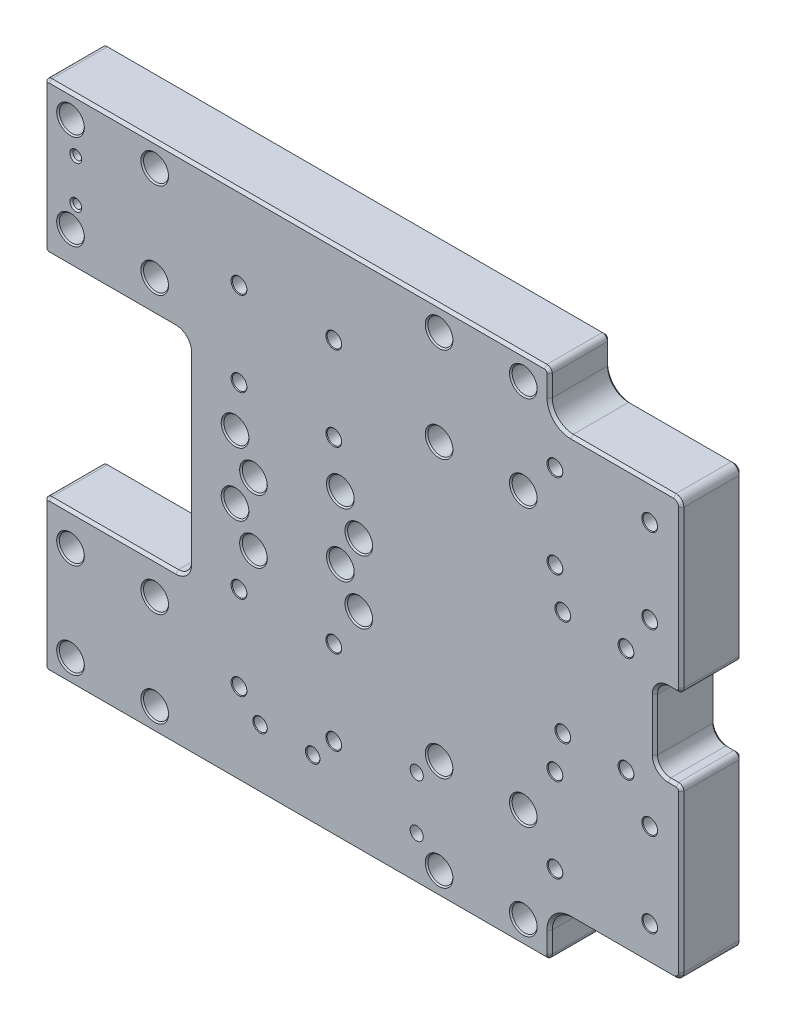
from build123d import *
from OCP.BRepFilletAPI import BRepFilletAPI_MakeFillet

# Parameters (mm, degrees)
SKETCH1_W                                     = 242
SKETCH1_H                                     = 195
BASE_FLANGE1_DEPTH                            = 23
CBORE_FOR_M5_HEX_SOCKET_HEAD_CAP_SCR_2_COUNT  = 2
CBORE_FOR_M5_HEX_SOCKET_HEAD_CAP_SCR_2_PITCH  = 32
CBORE_FOR_M5_HEX_SOCKET_HEAD_CAP_SCR_3_COUNT  = 2
CBORE_FOR_M5_HEX_SOCKET_HEAD_CAP_SCR_3_PITCH  = 48.166378315
CBORE_FOR_M5_HEX_SOCKET_HEAD_CAP_SCR_4_COUNT  = 2
CBORE_FOR_M5_HEX_SOCKET_HEAD_CAP_SCR_4_PITCH  = 36
CBORE_FOR_M5_HEX_SOCKET_HEAD_CAP_SCR_5_COUNT  = 2
CBORE_FOR_M5_HEX_SOCKET_HEAD_CAP_SCR_5_PITCH  = 140
CBORE_FOR_M5_HEX_SOCKET_HEAD_CAP_SCR_6_COUNT  = 2
CBORE_FOR_M5_HEX_SOCKET_HEAD_CAP_SCR_6_PITCH  = 172
CBORE_FOR_M5_HEX_SOCKET_HEAD_CAP_SCR_7_COUNT  = 2
CBORE_FOR_M5_HEX_SOCKET_HEAD_CAP_SCR_7_PITCH  = 175.727061092
CBORE_FOR_M5_HEX_SOCKET_HEAD_CAP_SCR_8_COUNT  = 2
CBORE_FOR_M5_HEX_SOCKET_HEAD_CAP_SCR_8_PITCH  = 144.554487997
CBORE_FOR_M5_HEX_SOCKET_HEAD_CAP_SCR_9_COUNT  = 2
CBORE_FOR_M5_HEX_SOCKET_HEAD_CAP_SCR_9_PITCH  = 198.698263707
CBORE_FOR_M5_HEX_SOCKET_HEAD_CAP_SCR_10_COUNT = 2
CBORE_FOR_M5_HEX_SOCKET_HEAD_CAP_SCR_10_PITCH = 222.407284053
CBORE_FOR_M5_HEX_SOCKET_HEAD_CAP_SCR_11_COUNT = 2
CBORE_FOR_M5_HEX_SOCKET_HEAD_CAP_SCR_11_PITCH = 246.805591509
CBORE_FOR_M5_HEX_SOCKET_HEAD_CAP_SCR_12_COUNT = 2
CBORE_FOR_M5_HEX_SOCKET_HEAD_CAP_SCR_12_PITCH = 225.674544422
CBORE_FOR_M5_HEX_SOCKET_HEAD_CAP_SCR_13_COUNT = 2
CBORE_FOR_M5_HEX_SOCKET_HEAD_CAP_SCR_13_PITCH = 141
CBORE_FOR_M5_HEX_SOCKET_HEAD_CAP_SCR_14_COUNT = 2
CBORE_FOR_M5_HEX_SOCKET_HEAD_CAP_SCR_14_PITCH = 144.585614775
CBORE_FOR_M5_HEX_SOCKET_HEAD_CAP_SCR_15_COUNT = 2
CBORE_FOR_M5_HEX_SOCKET_HEAD_CAP_SCR_15_PITCH = 179.869397064
CBORE_FOR_M5_HEX_SOCKET_HEAD_CAP_SCR_16_COUNT = 2
CBORE_FOR_M5_HEX_SOCKET_HEAD_CAP_SCR_16_PITCH = 177
CBORE_FOR_M5_HEX_SOCKET_HEAD_CAP_SCR_17_COUNT = 2
CBORE_FOR_M5_HEX_SOCKET_HEAD_CAP_SCR_17_PITCH = 40
CBORE_FOR_M5_HEX_SOCKET_HEAD_CAP_SCR_18_COUNT = 2
CBORE_FOR_M5_HEX_SOCKET_HEAD_CAP_SCR_18_PITCH = 46.647615159
CBORE_FOR_M5_HEX_SOCKET_HEAD_CAP_SCR_19_COUNT = 2
CBORE_FOR_M5_HEX_SOCKET_HEAD_CAP_SCR_19_PITCH = 24
CBORE_FOR_M5_HEX_SOCKET_HEAD_CAP_SCR_20_COUNT = 2
CBORE_FOR_M5_HEX_SOCKET_HEAD_CAP_SCR_20_PITCH = 13.892443989
CBORE_FOR_M5_HEX_SOCKET_HEAD_CAP_SCR_21_COUNT = 2
CBORE_FOR_M5_HEX_SOCKET_HEAD_CAP_SCR_21_PITCH = 35.114099732
CBORE_FOR_M5_HEX_SOCKET_HEAD_CAP_SCR_22_COUNT = 2
CBORE_FOR_M5_HEX_SOCKET_HEAD_CAP_SCR_22_PITCH = 48.836461788
CBORE_FOR_M5_HEX_SOCKET_HEAD_CAP_SCR_23_COUNT = 2
CBORE_FOR_M5_HEX_SOCKET_HEAD_CAP_SCR_23_PITCH = 36.674241642
CBORE_FOR_M5_HEX_SOCKET_HEAD_CAP_SCR_24_COUNT = 2
CBORE_FOR_M5_HEX_SOCKET_HEAD_CAP_SCR_24_PITCH = 36
CBORE_FOR_M5_HEX_SOCKET_HEAD_CAP_SCR_25_COUNT = 2
CBORE_FOR_M5_HEX_SOCKET_HEAD_CAP_SCR_25_PITCH = 48.166378315
CBORE_FOR_M5_HEX_SOCKET_HEAD_CAP_SCR_26_COUNT = 2
CBORE_FOR_M5_HEX_SOCKET_HEAD_CAP_SCR_26_PITCH = 32
CBORE_FOR_M5_HEX_SOCKET_HEAD_CAP_SCR_27_COUNT = 2
CBORE_FOR_M5_HEX_SOCKET_HEAD_CAP_SCR_27_PITCH = 106.282642045
CBORE_FOR_M5_HEX_SOCKET_HEAD_CAP_SCR_28_COUNT = 2
CBORE_FOR_M5_HEX_SOCKET_HEAD_CAP_SCR_28_PITCH = 136.821051012
CBORE_FOR_M5_HEX_SOCKET_HEAD_CAP_SCR_29_COUNT = 2
CBORE_FOR_M5_HEX_SOCKET_HEAD_CAP_SCR_29_PITCH = 100
CBORE_FOR_M5_HEX_SOCKET_HEAD_CAP_SCR_30_COUNT = 2
CBORE_FOR_M5_HEX_SOCKET_HEAD_CAP_SCR_30_PITCH = 132
CBORE_FOR_M5_HEX_SOCKET_HEAD_CAP_SCR_31_COUNT = 2
CBORE_FOR_M5_HEX_SOCKET_HEAD_CAP_SCR_31_PITCH = 120
CBORE_FOR_M5_HEX_SOCKET_HEAD_CAP_SCR_32_COUNT = 2
CBORE_FOR_M5_HEX_SOCKET_HEAD_CAP_SCR_32_PITCH = 156
CBORE_FOR_M5_HEX_SOCKET_HEAD_CAP_SCR_33_COUNT = 2
CBORE_FOR_M5_HEX_SOCKET_HEAD_CAP_SCR_33_PITCH = 159.248233899
CBORE_FOR_M5_HEX_SOCKET_HEAD_CAP_SCR_34_COUNT = 2
CBORE_FOR_M5_HEX_SOCKET_HEAD_CAP_SCR_34_PITCH = 124.19339757
CBORE_FOR_M5_HEX_SOCKET_HEAD_CAP_SCR_35_COUNT = 2
CBORE_FOR_M5_HEX_SOCKET_HEAD_CAP_SCR_35_PITCH = 185.29975715
CBORE_FOR_M5_HEX_SOCKET_HEAD_CAP_SCR_36_COUNT = 2
CBORE_FOR_M5_HEX_SOCKET_HEAD_CAP_SCR_36_PITCH = 204.352636391
CBORE_FOR_M5_HEX_SOCKET_HEAD_CAP_SCR_37_COUNT = 2
CBORE_FOR_M5_HEX_SOCKET_HEAD_CAP_SCR_37_PITCH = 156.204993518
CBORE_FOR_M5_HEX_SOCKET_HEAD_CAP_SCR_38_COUNT = 2
CBORE_FOR_M5_HEX_SOCKET_HEAD_CAP_SCR_38_PITCH = 178.392824968
CBORE_FOR_M5_HEX_SOCKET_HEAD_CAP_SCR_39_COUNT = 2
CBORE_FOR_M5_HEX_SOCKET_HEAD_CAP_SCR_39_PITCH = 40
CBORE_FOR_M5_HEX_SOCKET_HEAD_CAP_SCR_40_COUNT = 2
CBORE_FOR_M5_HEX_SOCKET_HEAD_CAP_SCR_40_PITCH = 46.647615159
CBORE_FOR_M5_HEX_SOCKET_HEAD_CAP_SCR_41_COUNT = 2
CBORE_FOR_M5_HEX_SOCKET_HEAD_CAP_SCR_41_PITCH = 24
CUT_EXTRUDE1_REACH                            = 159.087
SKETCH14_W                                    = 55
SKETCH14_H                                    = 80
SKETCH14_W_2                                  = 10
SKETCH14_H_2                                  = 30
M4_TAPPED_HOLE1_AT_2_COUNT                    = 2
M4_TAPPED_HOLE1_AT_2_PITCH                    = 16
CUT_EXTRUDE2_REACH                            = 159.087
SKETCH23_W                                    = 50
SKETCH23_H                                    = 18
F_5_0MM_DOWEL_HOLE1_D                         = 5
F_5_0MM_DOWEL_HOLE1_CSINK_D                   = 5.5
F_5_0MM_DOWEL_HOLE1_CSINK_ANGLE               = 90
F_5_0MM_DOWEL_HOLE2_D                         = 5
F_5_0MM_DOWEL_HOLE2_CSINK_D                   = 5.5
F_5_0MM_DOWEL_HOLE2_CSINK_ANGLE               = 90
FILLET1_R1                                    = 3
FILLET1_R2                                    = 5
FILLET1_R3                                    = 2
FILLET1_R4                                    = 8
CHAMFER1_SIZE                                 = 1
M5_TAPPED_HOLE1_D                             = 4.2
M5_TAPPED_HOLE1_DEPTH                         = 10.7381927
M5_TAPPED_HOLE1_TIP                           = 1.2618073


# Sheet-metal steps are written as plain solids
with BuildPart() as part:
    # Sketch1 → Base-Flange1 (new body)
    with BuildSketch(Plane.XY):
        Rectangle(SKETCH1_W, SKETCH1_H)
    extrude(amount=-BASE_FLANGE1_DEPTH)

    # Sketch8 → CBORE for M5 Hex Socket Head Cap Screw1 (revolve, cut)
    with BuildSketch(Plane(origin=(61, 88.5, 0), x_dir=(0, -1, 0), z_dir=(1, 0, 0))):
        Polygon((0, 0), (0, 23), (3, 23), (2.75, 22.75), (2.75, 8), (4.75, 8), (4.75, 0.5), (5.25, 0), align=None)
    cbore_for_m5_hex_socket_head_cap_screw1 = revolve(axis=Axis((61, 88.5, 6.35), (0, 0, -1)), mode=Mode.SUBTRACT)

    # CBORE for M5 Hex Socket Head Cap Scr 2: CBORE for M5 Hex Socket Head Cap Screw1 ×2
    with Locations(*[(-i * CBORE_FOR_M5_HEX_SOCKET_HEAD_CAP_SCR_2_PITCH, 0, 0) for i in range(1, CBORE_FOR_M5_HEX_SOCKET_HEAD_CAP_SCR_2_COUNT)]):
        add(cbore_for_m5_hex_socket_head_cap_screw1, mode=Mode.SUBTRACT)

    # CBORE for M5 Hex Socket Head Cap Scr 3: CBORE for M5 Hex Socket Head Cap Screw1 ×2
    with Locations(*[Vector(-0.6643638388299198, -0.7474093186836599, 0) * (i * CBORE_FOR_M5_HEX_SOCKET_HEAD_CAP_SCR_3_PITCH) for i in range(1, CBORE_FOR_M5_HEX_SOCKET_HEAD_CAP_SCR_3_COUNT)]):
        add(cbore_for_m5_hex_socket_head_cap_screw1, mode=Mode.SUBTRACT)

    # CBORE for M5 Hex Socket Head Cap Scr 4: CBORE for M5 Hex Socket Head Cap Screw1 ×2
    with Locations(*[(0, -i * CBORE_FOR_M5_HEX_SOCKET_HEAD_CAP_SCR_4_PITCH, 0) for i in range(1, CBORE_FOR_M5_HEX_SOCKET_HEAD_CAP_SCR_4_COUNT)]):
        add(cbore_for_m5_hex_socket_head_cap_screw1, mode=Mode.SUBTRACT)

    # CBORE for M5 Hex Socket Head Cap Scr 5: CBORE for M5 Hex Socket Head Cap Screw1 ×2
    with Locations(*[(-i * CBORE_FOR_M5_HEX_SOCKET_HEAD_CAP_SCR_5_PITCH, 0, 0) for i in range(1, CBORE_FOR_M5_HEX_SOCKET_HEAD_CAP_SCR_5_COUNT)]):
        add(cbore_for_m5_hex_socket_head_cap_screw1, mode=Mode.SUBTRACT)

    # CBORE for M5 Hex Socket Head Cap Scr 6: CBORE for M5 Hex Socket Head Cap Screw1 ×2
    with Locations(*[(-i * CBORE_FOR_M5_HEX_SOCKET_HEAD_CAP_SCR_6_PITCH, 0, 0) for i in range(1, CBORE_FOR_M5_HEX_SOCKET_HEAD_CAP_SCR_6_COUNT)]):
        add(cbore_for_m5_hex_socket_head_cap_screw1, mode=Mode.SUBTRACT)

    # CBORE for M5 Hex Socket Head Cap Scr 7: CBORE for M5 Hex Socket Head Cap Screw1 ×2
    with Locations(*[Vector(-0.9787906252528686, -0.20486315412269354, 0) * (i * CBORE_FOR_M5_HEX_SOCKET_HEAD_CAP_SCR_7_PITCH) for i in range(1, CBORE_FOR_M5_HEX_SOCKET_HEAD_CAP_SCR_7_COUNT)]):
        add(cbore_for_m5_hex_socket_head_cap_screw1, mode=Mode.SUBTRACT)

    # CBORE for M5 Hex Socket Head Cap Scr 8: CBORE for M5 Hex Socket Head Cap Screw1 ×2
    with Locations(*[Vector(-0.9684929325968497, -0.24904103981061862, 0) * (i * CBORE_FOR_M5_HEX_SOCKET_HEAD_CAP_SCR_8_PITCH) for i in range(1, CBORE_FOR_M5_HEX_SOCKET_HEAD_CAP_SCR_8_COUNT)]):
        add(cbore_for_m5_hex_socket_head_cap_screw1, mode=Mode.SUBTRACT)

    # CBORE for M5 Hex Socket Head Cap Scr 9: CBORE for M5 Hex Socket Head Cap Screw1 ×2
    with Locations(*[Vector(-0.7045859253544188, -0.7096186819640937, 0) * (i * CBORE_FOR_M5_HEX_SOCKET_HEAD_CAP_SCR_9_PITCH) for i in range(1, CBORE_FOR_M5_HEX_SOCKET_HEAD_CAP_SCR_9_COUNT)]):
        add(cbore_for_m5_hex_socket_head_cap_screw1, mode=Mode.SUBTRACT)

    # CBORE for M5 Hex Socket Head Cap Scr 10: CBORE for M5 Hex Socket Head Cap Screw1 ×2
    with Locations(*[Vector(-0.7733559659796021, -0.6339720418786277, 0) * (i * CBORE_FOR_M5_HEX_SOCKET_HEAD_CAP_SCR_10_PITCH) for i in range(1, CBORE_FOR_M5_HEX_SOCKET_HEAD_CAP_SCR_10_COUNT)]):
        add(cbore_for_m5_hex_socket_head_cap_screw1, mode=Mode.SUBTRACT)

    # CBORE for M5 Hex Socket Head Cap Scr 11: CBORE for M5 Hex Socket Head Cap Screw1 ×2
    with Locations(*[Vector(-0.6969047943708334, -0.7171636546723115, 0) * (i * CBORE_FOR_M5_HEX_SOCKET_HEAD_CAP_SCR_11_PITCH) for i in range(1, CBORE_FOR_M5_HEX_SOCKET_HEAD_CAP_SCR_11_COUNT)]):
        add(cbore_for_m5_hex_socket_head_cap_screw1, mode=Mode.SUBTRACT)

    # CBORE for M5 Hex Socket Head Cap Scr 12: CBORE for M5 Hex Socket Head Cap Screw1 ×2
    with Locations(*[Vector(-0.6203623911534888, -0.7843153088154827, 0) * (i * CBORE_FOR_M5_HEX_SOCKET_HEAD_CAP_SCR_12_PITCH) for i in range(1, CBORE_FOR_M5_HEX_SOCKET_HEAD_CAP_SCR_12_COUNT)]):
        add(cbore_for_m5_hex_socket_head_cap_screw1, mode=Mode.SUBTRACT)

    # CBORE for M5 Hex Socket Head Cap Scr 13: CBORE for M5 Hex Socket Head Cap Screw1 ×2
    with Locations(*[(0, -i * CBORE_FOR_M5_HEX_SOCKET_HEAD_CAP_SCR_13_PITCH, 0) for i in range(1, CBORE_FOR_M5_HEX_SOCKET_HEAD_CAP_SCR_13_COUNT)]):
        add(cbore_for_m5_hex_socket_head_cap_screw1, mode=Mode.SUBTRACT)

    # CBORE for M5 Hex Socket Head Cap Scr 14: CBORE for M5 Hex Socket Head Cap Screw1 ×2
    with Locations(*[Vector(-0.2213221560782096, -0.9752007502196113, 0) * (i * CBORE_FOR_M5_HEX_SOCKET_HEAD_CAP_SCR_14_PITCH) for i in range(1, CBORE_FOR_M5_HEX_SOCKET_HEAD_CAP_SCR_14_COUNT)]):
        add(cbore_for_m5_hex_socket_head_cap_screw1, mode=Mode.SUBTRACT)

    # CBORE for M5 Hex Socket Head Cap Scr 15: CBORE for M5 Hex Socket Head Cap Screw1 ×2
    with Locations(*[Vector(-0.17790686199218475, -0.9840473303942722, 0) * (i * CBORE_FOR_M5_HEX_SOCKET_HEAD_CAP_SCR_15_PITCH) for i in range(1, CBORE_FOR_M5_HEX_SOCKET_HEAD_CAP_SCR_15_COUNT)]):
        add(cbore_for_m5_hex_socket_head_cap_screw1, mode=Mode.SUBTRACT)

    # CBORE for M5 Hex Socket Head Cap Scr 16: CBORE for M5 Hex Socket Head Cap Screw1 ×2
    with Locations(*[(0, -i * CBORE_FOR_M5_HEX_SOCKET_HEAD_CAP_SCR_16_PITCH, 0) for i in range(1, CBORE_FOR_M5_HEX_SOCKET_HEAD_CAP_SCR_16_COUNT)]):
        add(cbore_for_m5_hex_socket_head_cap_screw1, mode=Mode.SUBTRACT)

    # Sketch10 → CBORE for M5 Hex Socket Head Cap Screw2 (revolve, cut)
    with BuildSketch(Plane(origin=(-8.5, 17.5, 0), x_dir=(0, -1, 0), z_dir=(1, 0, 0))):
        Polygon((0, 0), (0, 23), (3, 23), (2.75, 22.75), (2.75, 8), (4.75, 8), (4.75, 0.5), (5.25, 0), align=None)
    cbore_for_m5_hex_socket_head_cap_screw2 = revolve(axis=Axis((-8.5, 17.5, 6.35), (0, 0, -1)), mode=Mode.SUBTRACT)

    # CBORE for M5 Hex Socket Head Cap Scr 17: CBORE for M5 Hex Socket Head Cap Screw2 ×2
    with Locations(*[(-i * CBORE_FOR_M5_HEX_SOCKET_HEAD_CAP_SCR_17_PITCH, 0, 0) for i in range(1, CBORE_FOR_M5_HEX_SOCKET_HEAD_CAP_SCR_17_COUNT)]):
        add(cbore_for_m5_hex_socket_head_cap_screw2, mode=Mode.SUBTRACT)

    # CBORE for M5 Hex Socket Head Cap Scr 18: CBORE for M5 Hex Socket Head Cap Screw2 ×2
    with Locations(*[Vector(-0.8574929257125441, -0.5144957554275267, 0) * (i * CBORE_FOR_M5_HEX_SOCKET_HEAD_CAP_SCR_18_PITCH) for i in range(1, CBORE_FOR_M5_HEX_SOCKET_HEAD_CAP_SCR_18_COUNT)]):
        add(cbore_for_m5_hex_socket_head_cap_screw2, mode=Mode.SUBTRACT)

    # CBORE for M5 Hex Socket Head Cap Scr 19: CBORE for M5 Hex Socket Head Cap Screw2 ×2
    with Locations(*[(0, -i * CBORE_FOR_M5_HEX_SOCKET_HEAD_CAP_SCR_19_PITCH, 0) for i in range(1, CBORE_FOR_M5_HEX_SOCKET_HEAD_CAP_SCR_19_COUNT)]):
        add(cbore_for_m5_hex_socket_head_cap_screw2, mode=Mode.SUBTRACT)

    # CBORE for M5 Hex Socket Head Cap Scr 20: CBORE for M5 Hex Socket Head Cap Screw2 ×2
    with Locations(*[Vector(0.5038710255240865, -0.8637789008984332, 0) * (i * CBORE_FOR_M5_HEX_SOCKET_HEAD_CAP_SCR_20_PITCH) for i in range(1, CBORE_FOR_M5_HEX_SOCKET_HEAD_CAP_SCR_20_COUNT)]):
        add(cbore_for_m5_hex_socket_head_cap_screw2, mode=Mode.SUBTRACT)

    # CBORE for M5 Hex Socket Head Cap Scr 21: CBORE for M5 Hex Socket Head Cap Screw2 ×2
    with Locations(*[Vector(-0.9397934234884372, -0.34174306308670416, 0) * (i * CBORE_FOR_M5_HEX_SOCKET_HEAD_CAP_SCR_21_PITCH) for i in range(1, CBORE_FOR_M5_HEX_SOCKET_HEAD_CAP_SCR_21_COUNT)]):
        add(cbore_for_m5_hex_socket_head_cap_screw2, mode=Mode.SUBTRACT)

    # CBORE for M5 Hex Socket Head Cap Scr 22: CBORE for M5 Hex Socket Head Cap Screw2 ×2
    with Locations(*[Vector(-0.6757246285173464, -0.7371541402007413, 0) * (i * CBORE_FOR_M5_HEX_SOCKET_HEAD_CAP_SCR_22_PITCH) for i in range(1, CBORE_FOR_M5_HEX_SOCKET_HEAD_CAP_SCR_22_COUNT)]):
        add(cbore_for_m5_hex_socket_head_cap_screw2, mode=Mode.SUBTRACT)

    # CBORE for M5 Hex Socket Head Cap Scr 23: CBORE for M5 Hex Socket Head Cap Screw2 ×2
    with Locations(*[Vector(0.19086965910222412, -0.9816153896685813, 0) * (i * CBORE_FOR_M5_HEX_SOCKET_HEAD_CAP_SCR_23_PITCH) for i in range(1, CBORE_FOR_M5_HEX_SOCKET_HEAD_CAP_SCR_23_COUNT)]):
        add(cbore_for_m5_hex_socket_head_cap_screw2, mode=Mode.SUBTRACT)

    # Sketch13 → CBORE for M5 Hex Socket Head Cap Screw3 (revolve, cut)
    with BuildSketch(Plane(origin=(-47, 66, -23), x_dir=(0, 1, 0), z_dir=(1, 0, 0))):
        Polygon((0, 0), (0, 23), (3, 23), (2.75, 22.75), (2.75, 8), (4.75, 8), (4.75, 0.5), (5.25, 0), align=None)
    cbore_for_m5_hex_socket_head_cap_screw3 = revolve(axis=Axis((-47, 66, -29.35), (0, 0, 1)), mode=Mode.SUBTRACT)

    # CBORE for M5 Hex Socket Head Cap Scr 24: CBORE for M5 Hex Socket Head Cap Screw3 ×2
    with Locations(*[(i * CBORE_FOR_M5_HEX_SOCKET_HEAD_CAP_SCR_24_PITCH, 0, 0) for i in range(1, CBORE_FOR_M5_HEX_SOCKET_HEAD_CAP_SCR_24_COUNT)]):
        add(cbore_for_m5_hex_socket_head_cap_screw3, mode=Mode.SUBTRACT)

    # CBORE for M5 Hex Socket Head Cap Scr 25: CBORE for M5 Hex Socket Head Cap Screw3 ×2
    with Locations(*[Vector(0.7474093186836551, -0.6643638388299249, 0) * (i * CBORE_FOR_M5_HEX_SOCKET_HEAD_CAP_SCR_25_PITCH) for i in range(1, CBORE_FOR_M5_HEX_SOCKET_HEAD_CAP_SCR_25_COUNT)]):
        add(cbore_for_m5_hex_socket_head_cap_screw3, mode=Mode.SUBTRACT)

    # CBORE for M5 Hex Socket Head Cap Scr 26: CBORE for M5 Hex Socket Head Cap Screw3 ×2
    with Locations(*[(0, -i * CBORE_FOR_M5_HEX_SOCKET_HEAD_CAP_SCR_26_PITCH, 0) for i in range(1, CBORE_FOR_M5_HEX_SOCKET_HEAD_CAP_SCR_26_COUNT)]):
        add(cbore_for_m5_hex_socket_head_cap_screw3, mode=Mode.SUBTRACT)

    # CBORE for M5 Hex Socket Head Cap Scr 27: CBORE for M5 Hex Socket Head Cap Screw3 ×2
    with Locations(*[Vector(0.3387194682727424, -0.9408874118687266, 0) * (i * CBORE_FOR_M5_HEX_SOCKET_HEAD_CAP_SCR_27_PITCH) for i in range(1, CBORE_FOR_M5_HEX_SOCKET_HEAD_CAP_SCR_27_COUNT)]):
        add(cbore_for_m5_hex_socket_head_cap_screw3, mode=Mode.SUBTRACT)

    # CBORE for M5 Hex Socket Head Cap Scr 28: CBORE for M5 Hex Socket Head Cap Screw3 ×2
    with Locations(*[Vector(0.2631174057921073, -0.9647638212377325, 0) * (i * CBORE_FOR_M5_HEX_SOCKET_HEAD_CAP_SCR_28_PITCH) for i in range(1, CBORE_FOR_M5_HEX_SOCKET_HEAD_CAP_SCR_28_COUNT)]):
        add(cbore_for_m5_hex_socket_head_cap_screw3, mode=Mode.SUBTRACT)

    # CBORE for M5 Hex Socket Head Cap Scr 29: CBORE for M5 Hex Socket Head Cap Screw3 ×2
    with Locations(*[(0, -i * CBORE_FOR_M5_HEX_SOCKET_HEAD_CAP_SCR_29_PITCH, 0) for i in range(1, CBORE_FOR_M5_HEX_SOCKET_HEAD_CAP_SCR_29_COUNT)]):
        add(cbore_for_m5_hex_socket_head_cap_screw3, mode=Mode.SUBTRACT)

    # CBORE for M5 Hex Socket Head Cap Scr 30: CBORE for M5 Hex Socket Head Cap Screw3 ×2
    with Locations(*[(0, -i * CBORE_FOR_M5_HEX_SOCKET_HEAD_CAP_SCR_30_PITCH, 0) for i in range(1, CBORE_FOR_M5_HEX_SOCKET_HEAD_CAP_SCR_30_COUNT)]):
        add(cbore_for_m5_hex_socket_head_cap_screw3, mode=Mode.SUBTRACT)

    # CBORE for M5 Hex Socket Head Cap Scr 31: CBORE for M5 Hex Socket Head Cap Screw3 ×2
    with Locations(*[(i * CBORE_FOR_M5_HEX_SOCKET_HEAD_CAP_SCR_31_PITCH, 0, 0) for i in range(1, CBORE_FOR_M5_HEX_SOCKET_HEAD_CAP_SCR_31_COUNT)]):
        add(cbore_for_m5_hex_socket_head_cap_screw3, mode=Mode.SUBTRACT)

    # CBORE for M5 Hex Socket Head Cap Scr 32: CBORE for M5 Hex Socket Head Cap Screw3 ×2
    with Locations(*[(i * CBORE_FOR_M5_HEX_SOCKET_HEAD_CAP_SCR_32_PITCH, 0, 0) for i in range(1, CBORE_FOR_M5_HEX_SOCKET_HEAD_CAP_SCR_32_COUNT)]):
        add(cbore_for_m5_hex_socket_head_cap_screw3, mode=Mode.SUBTRACT)

    # CBORE for M5 Hex Socket Head Cap Scr 33: CBORE for M5 Hex Socket Head Cap Screw3 ×2
    with Locations(*[Vector(0.9796027006414888, -0.20094414372133815, 0) * (i * CBORE_FOR_M5_HEX_SOCKET_HEAD_CAP_SCR_33_PITCH) for i in range(1, CBORE_FOR_M5_HEX_SOCKET_HEAD_CAP_SCR_33_COUNT)]):
        add(cbore_for_m5_hex_socket_head_cap_screw3, mode=Mode.SUBTRACT)

    # CBORE for M5 Hex Socket Head Cap Scr 34: CBORE for M5 Hex Socket Head Cap Screw3 ×2
    with Locations(*[Vector(0.9662349396012445, -0.25766265056033916, 0) * (i * CBORE_FOR_M5_HEX_SOCKET_HEAD_CAP_SCR_34_PITCH) for i in range(1, CBORE_FOR_M5_HEX_SOCKET_HEAD_CAP_SCR_34_COUNT)]):
        add(cbore_for_m5_hex_socket_head_cap_screw3, mode=Mode.SUBTRACT)

    # CBORE for M5 Hex Socket Head Cap Scr 35: CBORE for M5 Hex Socket Head Cap Screw3 ×2
    with Locations(*[Vector(0.8418791389638736, -0.5396661147204326, 0) * (i * CBORE_FOR_M5_HEX_SOCKET_HEAD_CAP_SCR_35_PITCH) for i in range(1, CBORE_FOR_M5_HEX_SOCKET_HEAD_CAP_SCR_35_COUNT)]):
        add(cbore_for_m5_hex_socket_head_cap_screw3, mode=Mode.SUBTRACT)

    # CBORE for M5 Hex Socket Head Cap Scr 36: CBORE for M5 Hex Socket Head Cap Screw3 ×2
    with Locations(*[Vector(0.7633862853691121, -0.6459422414661768, 0) * (i * CBORE_FOR_M5_HEX_SOCKET_HEAD_CAP_SCR_36_PITCH) for i in range(1, CBORE_FOR_M5_HEX_SOCKET_HEAD_CAP_SCR_36_COUNT)]):
        add(cbore_for_m5_hex_socket_head_cap_screw3, mode=Mode.SUBTRACT)

    # CBORE for M5 Hex Socket Head Cap Scr 37: CBORE for M5 Hex Socket Head Cap Screw3 ×2
    with Locations(*[Vector(0.7682212795973714, -0.6401843996644853, 0) * (i * CBORE_FOR_M5_HEX_SOCKET_HEAD_CAP_SCR_37_PITCH) for i in range(1, CBORE_FOR_M5_HEX_SOCKET_HEAD_CAP_SCR_37_COUNT)]):
        add(cbore_for_m5_hex_socket_head_cap_screw3, mode=Mode.SUBTRACT)

    # CBORE for M5 Hex Socket Head Cap Scr 38: CBORE for M5 Hex Socket Head Cap Screw3 ×2
    with Locations(*[Vector(0.672672793996308, -0.7399400733959478, 0) * (i * CBORE_FOR_M5_HEX_SOCKET_HEAD_CAP_SCR_38_PITCH) for i in range(1, CBORE_FOR_M5_HEX_SOCKET_HEAD_CAP_SCR_38_COUNT)]):
        add(cbore_for_m5_hex_socket_head_cap_screw3, mode=Mode.SUBTRACT)

    # Sketch16 → CBORE for M5 Hex Socket Head Cap Screw4 (revolve, cut)
    with BuildSketch(Plane(origin=(100, 20, -23), x_dir=(0, 1, 0), z_dir=(1, 0, 0))):
        Polygon((0, 0), (0, 23), (3, 23), (2.75, 22.75), (2.75, 8), (4.75, 8), (4.75, 0.5), (5.25, 0), align=None)
    cbore_for_m5_hex_socket_head_cap_screw4 = revolve(axis=Axis((100, 20, -29.35), (0, 0, 1)), mode=Mode.SUBTRACT)

    # CBORE for M5 Hex Socket Head Cap Scr 39: CBORE for M5 Hex Socket Head Cap Screw4 ×2
    with Locations(*[(0, -i * CBORE_FOR_M5_HEX_SOCKET_HEAD_CAP_SCR_39_PITCH, 0) for i in range(1, CBORE_FOR_M5_HEX_SOCKET_HEAD_CAP_SCR_39_COUNT)]):
        add(cbore_for_m5_hex_socket_head_cap_screw4, mode=Mode.SUBTRACT)

    # CBORE for M5 Hex Socket Head Cap Scr 40: CBORE for M5 Hex Socket Head Cap Screw4 ×2
    with Locations(*[Vector(-0.5144957554275263, -0.8574929257125444, 0) * (i * CBORE_FOR_M5_HEX_SOCKET_HEAD_CAP_SCR_40_PITCH) for i in range(1, CBORE_FOR_M5_HEX_SOCKET_HEAD_CAP_SCR_40_COUNT)]):
        add(cbore_for_m5_hex_socket_head_cap_screw4, mode=Mode.SUBTRACT)

    # CBORE for M5 Hex Socket Head Cap Scr 41: CBORE for M5 Hex Socket Head Cap Screw4 ×2
    with Locations(*[(-i * CBORE_FOR_M5_HEX_SOCKET_HEAD_CAP_SCR_41_PITCH, 0, 0) for i in range(1, CBORE_FOR_M5_HEX_SOCKET_HEAD_CAP_SCR_41_COUNT)]):
        add(cbore_for_m5_hex_socket_head_cap_screw4, mode=Mode.SUBTRACT)

    # Sketch14 → Cut-Extrude1 (cut, up to next)
    with BuildSketch(Plane(origin=(0, 0, -23), x_dir=(-1, 0, 0), z_dir=(0, 0, -1)), mode=Mode.PRIVATE) as cut_extrude1_sk1:
        with Locations((93.5, 0)):
            Rectangle(SKETCH14_W, SKETCH14_H)
    cut_extrude1_tool1 = extrude(cut_extrude1_sk1.sketch, amount=-CUT_EXTRUDE1_REACH, mode=Mode.PRIVATE) & part.part
    # Sketch14 → Cut-Extrude1 (cut, up to next)
    with BuildSketch(Plane(origin=(0, 0, -23), x_dir=(-1, 0, 0), z_dir=(0, 0, -1)), mode=Mode.PRIVATE) as cut_extrude1_sk2:
        with Locations((-116, 0)):
            Rectangle(SKETCH14_W_2, SKETCH14_H_2)
    cut_extrude1_tool2 = extrude(cut_extrude1_sk2.sketch, amount=-CUT_EXTRUDE1_REACH, mode=Mode.PRIVATE) & part.part
    add(cut_extrude1_tool1.solids().sort_by_distance((-93.5, 0, -23))[0], mode=Mode.SUBTRACT)
    add(cut_extrude1_tool2.solids().sort_by_distance((116, 0, -23))[0], mode=Mode.SUBTRACT)

    # Sketch22 → M4 Tapped Hole1 (revolve, cut)
    with BuildSketch(Plane(origin=(-109, 77.5, 0), x_dir=(0, -1, 0), z_dir=(1, 0, 0))):
        Polygon((0, 0), (0, 23), (2.25, 23), (1.65, 22.4), (1.65, 0.6), (2.25, 0), align=None)
    m4_tapped_hole1 = revolve(axis=Axis((-109, 77.5, 6.35), (0, 0, -1)), mode=Mode.SUBTRACT)

    # M4 Tapped Hole1 at 2: M4 Tapped Hole1 ×2
    with Locations(*[(0, -i * M4_TAPPED_HOLE1_AT_2_PITCH, 0) for i in range(1, M4_TAPPED_HOLE1_AT_2_COUNT)]):
        add(m4_tapped_hole1, mode=Mode.SUBTRACT)

    # Sketch23 → Cut-Extrude2 (cut, up to next)
    with BuildSketch(Plane.XY, mode=Mode.PRIVATE) as cut_extrude2_sk1:
        with Locations((96, 88.5)):
            Rectangle(SKETCH23_W, SKETCH23_H)
    cut_extrude2_tool1 = extrude(cut_extrude2_sk1.sketch, amount=-CUT_EXTRUDE2_REACH, mode=Mode.PRIVATE) & part.part
    # Sketch23 → Cut-Extrude2 (cut, up to next)
    with BuildSketch(Plane.XY, mode=Mode.PRIVATE) as cut_extrude2_sk2:
        with Locations((96, -88.5)):
            Rectangle(SKETCH23_W, SKETCH23_H)
    cut_extrude2_tool2 = extrude(cut_extrude2_sk2.sketch, amount=-CUT_EXTRUDE2_REACH, mode=Mode.PRIVATE) & part.part
    add(cut_extrude2_tool1.solids().sort_by_distance((96, 88.5, 0))[0], mode=Mode.SUBTRACT)
    add(cut_extrude2_tool2.solids().sort_by_distance((96, -88.5, 0))[0], mode=Mode.SUBTRACT)

    # Ø5.0mm Dowel Hole1 (through all)
    with Locations(Plane(origin=(0, 0, -23), x_dir=(-1, 0, 0), z_dir=(0, 0, -1))):
        with Locations((-20.5, -80.5), (-20.5, -60.5)):
            CounterSinkHole(F_5_0MM_DOWEL_HOLE1_D / 2, F_5_0MM_DOWEL_HOLE1_CSINK_D / 2, counter_sink_angle=F_5_0MM_DOWEL_HOLE1_CSINK_ANGLE)

    # Ø5.0mm Dowel Hole2 (through all)
    with Locations(Plane.XY):
        with Locations((-19, -74.5), (-39, -74.5)):
            CounterSinkHole(F_5_0MM_DOWEL_HOLE2_D / 2, F_5_0MM_DOWEL_HOLE2_CSINK_D / 2, counter_sink_angle=F_5_0MM_DOWEL_HOLE2_CSINK_ANGLE)

    # Fillet1: one fillet with a radius per group of edges: ONE call of the kernel's fillet builder (fillet() takes one radius for all edges)
    fillet1_edges_1 = [part.edges().sort_by_distance(p)[0] for p in [
        (121, -79.5, -11.5),
        (121, 79.5, -11.5),
    ]]
    fillet1_edges_2 = [part.edges().sort_by_distance(p)[0] for p in [
        (-66, 40, -11.5),
        (-66, -40, -11.5),
        (111, -15, -11.5),
        (111, 15, -11.5),
    ]]
    fillet1_edges_3 = [part.edges().sort_by_distance(p)[0] for p in [
        (-121, 97.5, -11.5),
        (-121, 40, -11.5),
        (-121, -40, -11.5),
        (-121, -97.5, -11.5),
        (121, -15, -11.5),
        (121, 15, -11.5),
        (71, -97.5, -11.5),
        (71, 97.5, -11.5),
    ]]
    fillet1_edges_4 = [part.edges().sort_by_distance(p)[0] for p in [
        (71, -79.5, -11.5),
        (71, 79.5, -11.5),
    ]]
    fillet1 = BRepFilletAPI_MakeFillet(part.part.solid().wrapped)
    for e in fillet1_edges_1:
        fillet1.Add(FILLET1_R1, e.wrapped)
    for e in fillet1_edges_2:
        fillet1.Add(FILLET1_R2, e.wrapped)
    for e in fillet1_edges_3:
        fillet1.Add(FILLET1_R3, e.wrapped)
    for e in fillet1_edges_4:
        fillet1.Add(FILLET1_R4, e.wrapped)
    add(Compound.cast(fillet1.Shape()), mode=Mode.REPLACE)

    # Chamfer1
    chamfer1_edges = [part.edges().sort_by_distance(p)[0] for p in [
        (98.5, 79.5, 0),
        (98.5, 79.5, -23),
        (71, 91.5, 0),
        (71, 91.5, -23),
        (71, -91.5, 0),
        (71, -91.5, -23),
        (98.5, -79.5, 0),
        (98.5, -79.5, -23),
        (-25, 97.5, 0),
        (-121, 68.75, 0),
        (-95, 40, 0),
        (-66, 0, 0),
        (-95, -40, 0),
        (-121, -68.75, 0),
        (-25, -97.5, 0),
        (121, -46.75, 0),
        (117.5, -15, 0),
        (111, 0, 0),
        (117.5, 15, 0),
        (121, 46.75, 0),
        (120.121320344, -78.621320344, 0),
        (120.121320344, 78.621320344, 0),
        (-120.414213562, 96.914213562, 0),
        (-120.414213562, 40.585786438, 0),
        (-120.414213562, -40.585786438, 0),
        (-120.414213562, -96.914213562, 0),
        (120.414213562, -15.585786438, 0),
        (120.414213562, 15.585786438, 0),
        (70.414213562, -96.914213562, 0),
        (70.414213562, 96.914213562, 0),
        (-25, 97.5, -23),
        (121, 46.75, -23),
        (117.5, 15, -23),
        (111, 0, -23),
        (117.5, -15, -23),
        (121, -46.75, -23),
        (-25, -97.5, -23),
        (-121, -68.75, -23),
        (-95, -40, -23),
        (-66, 0, -23),
        (-95, 40, -23),
        (-121, 68.75, -23),
        (120.121320344, -78.621320344, -23),
        (120.121320344, 78.621320344, -23),
        (-120.414213562, 96.914213562, -23),
        (-120.414213562, 40.585786438, -23),
        (-120.414213562, -40.585786438, -23),
        (-120.414213562, -96.914213562, -23),
        (120.414213562, -15.585786438, -23),
        (120.414213562, 15.585786438, -23),
        (70.414213562, -96.914213562, -23),
        (70.414213562, 96.914213562, -23),
        (73.343145751, 81.843145751, 0),
        (73.343145751, 81.843145751, -23),
        (73.343145751, -81.843145751, 0),
        (73.343145751, -81.843145751, -23),
        (112.464466094, 13.535533906, -23),
        (112.464466094, 13.535533906, 0),
        (112.464466094, -13.535533906, -23),
        (112.464466094, -13.535533906, 0),
        (-67.464466094, -38.535533906, -23),
        (-67.464466094, -38.535533906, 0),
        (-67.464466094, 38.535533906, -23),
        (-67.464466094, 38.535533906, 0),
    ]]
    chamfer(chamfer1_edges, length=CHAMFER1_SIZE)

    # M5 Tapped Hole1
    with Locations(Plane(origin=(0, -79.5, 0), x_dir=(-1, 0, 0), z_dir=(0, -1, 0))):
        with Locations((-98.5, 11.5), (-83.5, 11.5)):
            Hole(M5_TAPPED_HOLE1_D / 2, depth=M5_TAPPED_HOLE1_DEPTH)
            with Locations((0, 0, -(M5_TAPPED_HOLE1_DEPTH + M5_TAPPED_HOLE1_TIP / 2))):  # 118° drill point
                Cone(0, M5_TAPPED_HOLE1_D / 2, M5_TAPPED_HOLE1_TIP, mode=Mode.SUBTRACT)


solid = part.part
